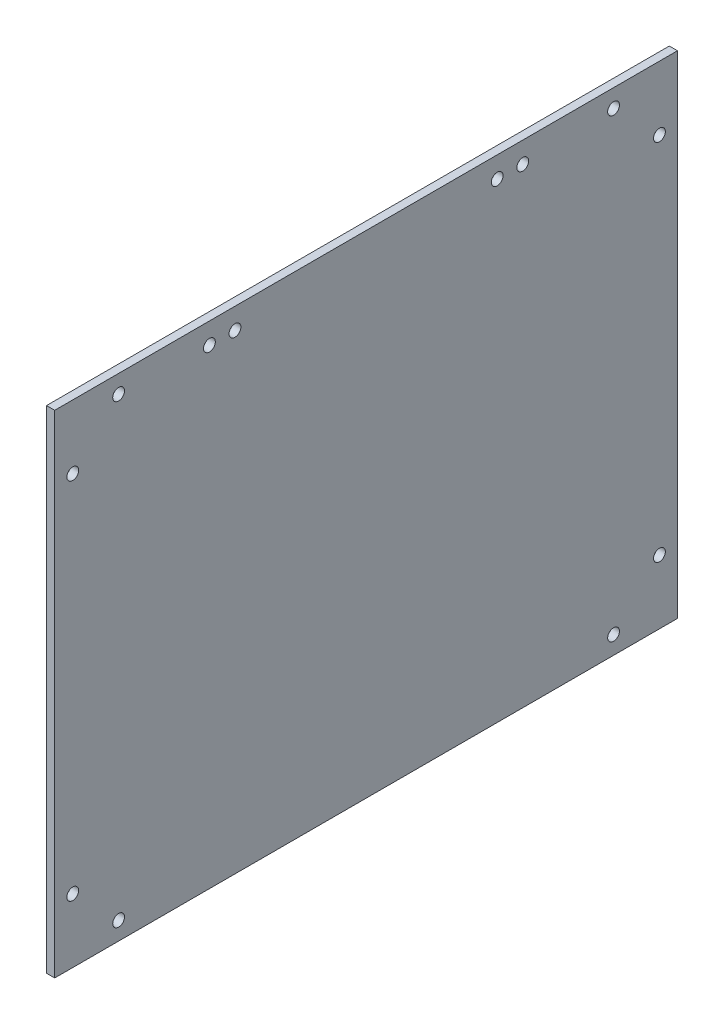
from build123d import *

# Parameters (mm, degrees)
SKETCH1_W           = 241.3
SKETCH1_H           = 190.5
BOSS_EXTRUDE1_DEPTH = 3.175
SKETCH2_R           = 2.286
CUT_EXTRUDE1_DEPTH  = 308.450842616
SKETCH3_R           = 2.286
CUT_EXTRUDE2_DEPTH  = 308.450842616


with BuildPart() as part:
    # Sketch1 → Boss-Extrude1 (new body)
    with BuildSketch(Plane(origin=(0, 0, 0), x_dir=(0, 0, -1), z_dir=(1, 0, 0))):
        with Locations((120.65, 95.25)):
            Rectangle(SKETCH1_W, SKETCH1_H)
    extrude(amount=BOSS_EXTRUDE1_DEPTH)

    # Sketch2 → Cut-Extrude1 (cut, through all)
    with BuildSketch(Plane(origin=(3.175, 0, 0), x_dir=(0, 0, -1), z_dir=(1, 0, 0))):
        with Locations((216.535, 6.985)):
            Circle(SKETCH2_R)
        with Locations((234.315, 24.765)):
            Circle(SKETCH2_R)
        with Locations((234.315, 165.735)):
            Circle(SKETCH2_R)
        with Locations((216.535, 183.515)):
            Circle(SKETCH2_R)
        with Locations((24.765, 183.515)):
            Circle(SKETCH2_R)
        with Locations((6.985, 165.735)):
            Circle(SKETCH2_R)
        with Locations((6.985, 24.765)):
            Circle(SKETCH2_R)
        with Locations((24.765, 6.985)):
            Circle(SKETCH2_R)
    extrude(amount=-CUT_EXTRUDE1_DEPTH, mode=Mode.SUBTRACT)

    # Sketch3 → Cut-Extrude2 (cut, through all)
    with BuildSketch(Plane(origin=(3.175, 0, 0), x_dir=(0, 0, -1), z_dir=(1, 0, 0))):
        with Locations((59.944, 182.372)):
            Circle(SKETCH3_R)
        with Locations((69.85, 182.372)):
            Circle(SKETCH3_R)
        with Locations((171.45, 182.372)):
            Circle(SKETCH3_R)
        with Locations((181.356, 182.372)):
            Circle(SKETCH3_R)
    extrude(amount=-CUT_EXTRUDE2_DEPTH, mode=Mode.SUBTRACT)


solid = part.part
